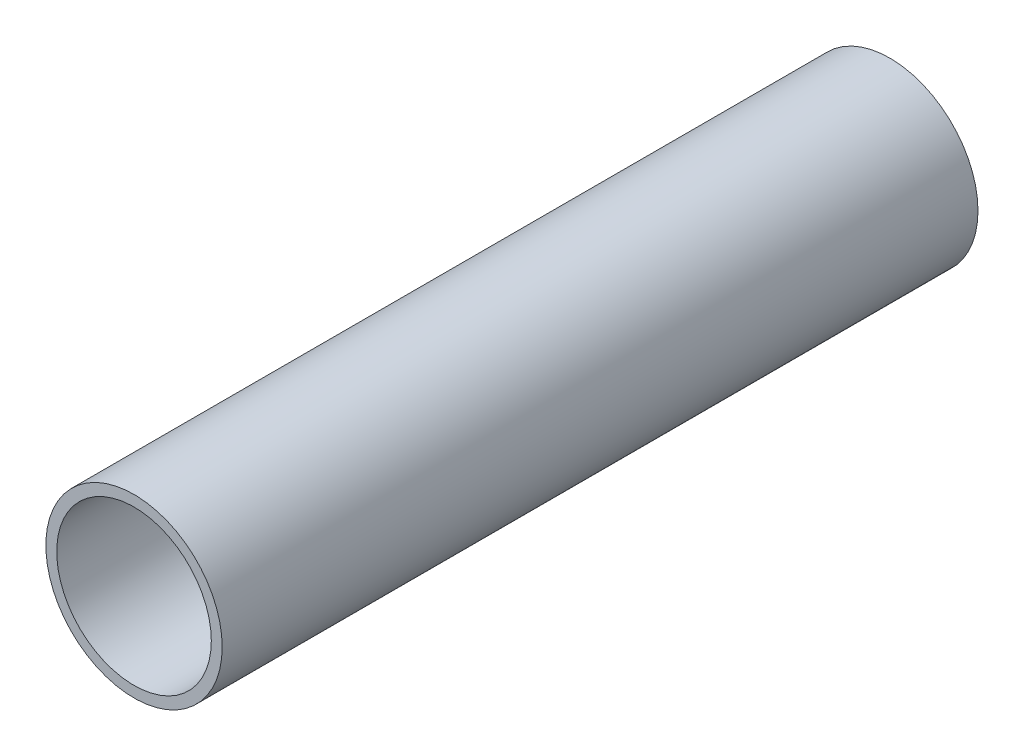
from build123d import *

# Parameters (mm, degrees)
SKETCH1_R           = 44.45
SKETCH1_R_2         = 38.9636
EXTRUDE_THIN1_DEPTH = 190.5


with BuildPart() as part:
    # Sketch1 → Extrude-Thin1 (new, symmetric)
    with BuildSketch(Plane.XY):
        Circle(SKETCH1_R)
        Circle(SKETCH1_R_2, mode=Mode.SUBTRACT)
    extrude(amount=EXTRUDE_THIN1_DEPTH, both=True)


solid = part.part
